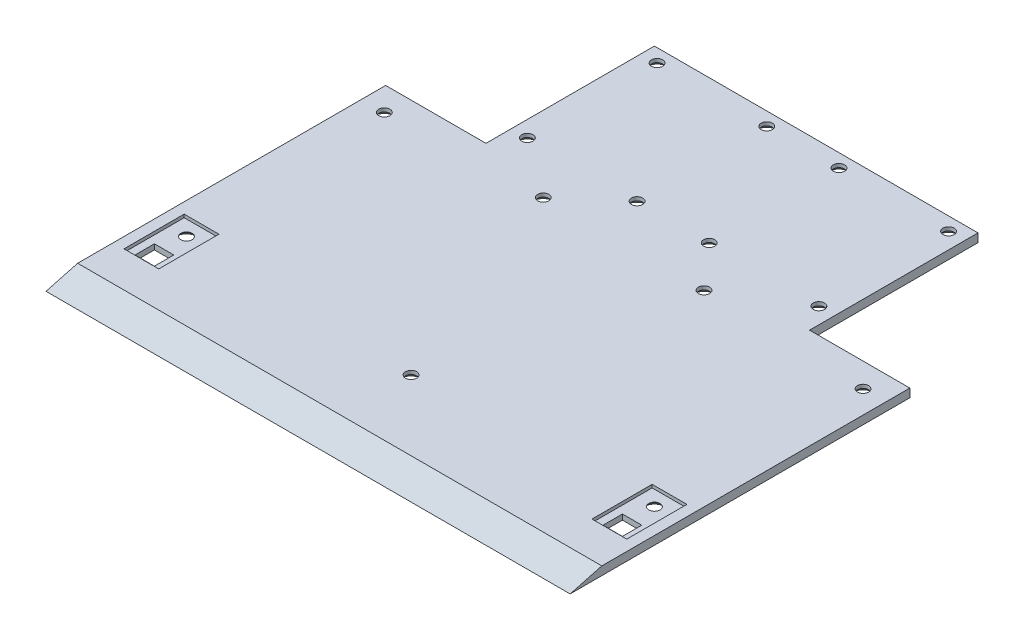
from build123d import *

# Parameters (mm, degrees)
SALIENTE_EXTRUIR1_DEPTH                              = 196
CORTAR_EXTRUIR1_REACH                                = 274.995
CROQUIS2_W                                           = 37.5
CROQUIS2_H                                           = 62.989872981
CROQUIS3_W                                           = 13
CROQUIS3_H                                           = 22.5
CORTAR_EXTRUIR2_DEPTH                                = 1.17
CORTAR_EXTRUIR3_REACH                                = 274.984
CROQUIS5_W                                           = 7.25
CROQUIS5_H                                           = 7.25
CORTAR_EXTRUIR4_REACH                                = 274.984
CROQUIS6_R                                           = 1.6
CUT_EXTRUDE1_REACH                                   = 274.995
SKETCH1_R                                            = 1.585
CUT_EXTRUDE2_REACH                                   = 274.995
SKETCH2_R                                            = 1.585
CUT_EXTRUDE3_REACH                                   = 274.995
SKETCH3_R                                            = 1.579889923
SKETCH3_R_2                                          = 1.585
SKETCH4_R                                            = 1.6
CUT_EXTRUDE4_DEPTH                                   = 4.9
AVELLANADO_PARA_TORNILLO_CON_CABEZA_AVEL_D           = 4.2
AVELLANADO_PARA_TORNILLO_CON_CABEZA_AVEL_DEPTH       = 10
AVELLANADO_PARA_TORNILLO_CON_CABEZA_AVEL_CSINK_D     = 8
AVELLANADO_PARA_TORNILLO_CON_CABEZA_AVEL_CSINK_ANGLE = 92
AVELLANADO_PARA_TORNILLO_CON_CABEZA_AVEL_TIP         = 1.2618073


with BuildPart() as part:
    # Croquis1 → Saliente-Extruir1 (new body)
    with BuildSketch(Plane(origin=(0, 0, 0), x_dir=(0, 0, -1), z_dir=(1, 0, 0))):
        Polygon((0, 0), (190, 0), (190, 3.17), (11.83060106, 3.17), align=None)
    extrude(amount=SALIENTE_EXTRUIR1_DEPTH)

    # Croquis2 → Cortar-Extruir1 (cut, up to next)
    with BuildSketch(Plane(origin=(0, 0, 0), x_dir=(-1, 0, 0), z_dir=(0, -1, 0)), mode=Mode.PRIVATE) as cortar_extruir1_sk1:
        with Locations((-18.75, 158.50506351)):
            Rectangle(CROQUIS2_W, CROQUIS2_H)
    cortar_extruir1_tool1 = extrude(cortar_extruir1_sk1.sketch, amount=-CORTAR_EXTRUIR1_REACH, mode=Mode.PRIVATE) & part.part
    cortar_extruir1 = cortar_extruir1_tool1.solids().sort_by_distance((18.75, 0, -158.505064))[0]
    add(cortar_extruir1, mode=Mode.SUBTRACT)

    # Simetría1: Cortar-Extruir1 across plane
    add(cortar_extruir1.mirror(Plane.ZY.offset(-98)), mode=Mode.SUBTRACT)

    # Croquis3 → Cortar-Extruir2 (cut)
    with BuildSketch(Plane(origin=(0, 3.17, 0), x_dir=(1, 0, 0), z_dir=(0, 1, 0))):
        with Locations((10.5, 36.41)):
            Rectangle(CROQUIS3_W, CROQUIS3_H)
    cortar_extruir2 = extrude(amount=-CORTAR_EXTRUIR2_DEPTH, mode=Mode.SUBTRACT)

    # Croquis5 → Cortar-Extruir3 (cut, up to next)
    with BuildSketch(Plane(origin=(0, 2, 0), x_dir=(1, 0, 0), z_dir=(0, 1, 0)), mode=Mode.PRIVATE) as cortar_extruir3_sk1:
        with Locations((10.5, 30.035)):
            Rectangle(CROQUIS5_W, CROQUIS5_H)
    cortar_extruir3_tool1 = extrude(cortar_extruir3_sk1.sketch, amount=-CORTAR_EXTRUIR3_REACH, mode=Mode.PRIVATE) & part.part
    cortar_extruir3 = cortar_extruir3_tool1.solids().sort_by_distance((10.5, 2, -30.035))[0]
    add(cortar_extruir3, mode=Mode.SUBTRACT)

    # Croquis6 → Cortar-Extruir4 (cut, up to next)
    with BuildSketch(Plane(origin=(0, 2, 0), x_dir=(1, 0, 0), z_dir=(0, 1, 0)), mode=Mode.PRIVATE) as cortar_extruir4_sk1:
        with Locations((10.5, 42.01)):
            Circle(CROQUIS6_R)
    cortar_extruir4_tool1 = extrude(cortar_extruir4_sk1.sketch, amount=-CORTAR_EXTRUIR4_REACH, mode=Mode.PRIVATE) & part.part
    cortar_extruir4 = cortar_extruir4_tool1.solids().sort_by_distance((10.5, 2, -42.01))[0]
    add(cortar_extruir4, mode=Mode.SUBTRACT)

    # Simetría2: Cortar-Extruir2, Cortar-Extruir3, Cortar-Extruir4 across plane
    add(cortar_extruir2.mirror(Plane.ZY.offset(-98)), mode=Mode.SUBTRACT)
    add(cortar_extruir3.mirror(Plane.ZY.offset(-98)), mode=Mode.SUBTRACT)
    add(cortar_extruir4.mirror(Plane.ZY.offset(-98)), mode=Mode.SUBTRACT)

    # Sketch1 → Cut-Extrude1 (cut, up to next)
    with BuildSketch(Plane(origin=(0, 3.17, 0), x_dir=(1, 0, 0), z_dir=(0, 1, 0)), mode=Mode.PRIVATE) as cut_extrude1_sk1:
        with Locations((8.5, 118.010127019)):
            Circle(SKETCH1_R)
    cut_extrude1_tool1 = extrude(cut_extrude1_sk1.sketch, amount=-CUT_EXTRUDE1_REACH, mode=Mode.PRIVATE) & part.part
    # Sketch1 → Cut-Extrude1 (cut, up to next)
    with BuildSketch(Plane(origin=(0, 3.17, 0), x_dir=(1, 0, 0), z_dir=(0, 1, 0)), mode=Mode.PRIVATE) as cut_extrude1_sk2:
        with Locations((187.5, 118.010127019)):
            Circle(SKETCH1_R)
    cut_extrude1_tool2 = extrude(cut_extrude1_sk2.sketch, amount=-CUT_EXTRUDE1_REACH, mode=Mode.PRIVATE) & part.part
    add(cut_extrude1_tool1.solids().sort_by_distance((8.5, 3.17, -118.010127))[0], mode=Mode.SUBTRACT)
    add(cut_extrude1_tool2.solids().sort_by_distance((187.5, 3.17, -118.010127))[0], mode=Mode.SUBTRACT)

    # Sketch2 → Cut-Extrude2 (cut, up to next)
    with BuildSketch(Plane(origin=(0, 3.17, 0), x_dir=(1, 0, 0), z_dir=(0, 1, 0)), mode=Mode.PRIVATE) as cut_extrude2_sk1:
        with Locations((98.5, 38.010127019)):
            Circle(SKETCH2_R)
    cut_extrude2_tool1 = extrude(cut_extrude2_sk1.sketch, amount=-CUT_EXTRUDE2_REACH, mode=Mode.PRIVATE) & part.part
    add(cut_extrude2_tool1.solids().sort_by_distance((98.5, 3.17, -38.010127))[0], mode=Mode.SUBTRACT)

    # Sketch3 → Cut-Extrude3 (cut, up to next)
    with BuildSketch(Plane(origin=(0, 3.17, 0), x_dir=(1, 0, 0), z_dir=(0, 1, 0)), mode=Mode.PRIVATE) as cut_extrude3_sk1:
        with Locations((43.5, 185)):
            Circle(SKETCH3_R)
    cut_extrude3_tool1 = extrude(cut_extrude3_sk1.sketch, amount=-CUT_EXTRUDE3_REACH, mode=Mode.PRIVATE) & part.part
    # Sketch3 → Cut-Extrude3 (cut, up to next)
    with BuildSketch(Plane(origin=(0, 3.17, 0), x_dir=(1, 0, 0), z_dir=(0, 1, 0)), mode=Mode.PRIVATE) as cut_extrude3_sk2:
        with Locations((84.5, 185)):
            Circle(SKETCH3_R_2)
    cut_extrude3_tool2 = extrude(cut_extrude3_sk2.sketch, amount=-CUT_EXTRUDE3_REACH, mode=Mode.PRIVATE) & part.part
    # Sketch3 → Cut-Extrude3 (cut, up to next)
    with BuildSketch(Plane(origin=(0, 3.17, 0), x_dir=(1, 0, 0), z_dir=(0, 1, 0)), mode=Mode.PRIVATE) as cut_extrude3_sk3:
        with Locations((152.5, 185)):
            Circle(SKETCH3_R_2)
    cut_extrude3_tool3 = extrude(cut_extrude3_sk3.sketch, amount=-CUT_EXTRUDE3_REACH, mode=Mode.PRIVATE) & part.part
    # Sketch3 → Cut-Extrude3 (cut, up to next)
    with BuildSketch(Plane(origin=(0, 3.17, 0), x_dir=(1, 0, 0), z_dir=(0, 1, 0)), mode=Mode.PRIVATE) as cut_extrude3_sk4:
        with Locations((111.5, 185)):
            Circle(SKETCH3_R_2)
    cut_extrude3_tool4 = extrude(cut_extrude3_sk4.sketch, amount=-CUT_EXTRUDE3_REACH, mode=Mode.PRIVATE) & part.part
    # Sketch3 → Cut-Extrude3 (cut, up to next)
    with BuildSketch(Plane(origin=(0, 3.17, 0), x_dir=(1, 0, 0), z_dir=(0, 1, 0)), mode=Mode.PRIVATE) as cut_extrude3_sk5:
        with Locations((111.5, 136.5)):
            Circle(SKETCH3_R_2)
    cut_extrude3_tool5 = extrude(cut_extrude3_sk5.sketch, amount=-CUT_EXTRUDE3_REACH, mode=Mode.PRIVATE) & part.part
    # Sketch3 → Cut-Extrude3 (cut, up to next)
    with BuildSketch(Plane(origin=(0, 3.17, 0), x_dir=(1, 0, 0), z_dir=(0, 1, 0)), mode=Mode.PRIVATE) as cut_extrude3_sk6:
        with Locations((152.5, 136.5)):
            Circle(SKETCH3_R_2)
    cut_extrude3_tool6 = extrude(cut_extrude3_sk6.sketch, amount=-CUT_EXTRUDE3_REACH, mode=Mode.PRIVATE) & part.part
    # Sketch3 → Cut-Extrude3 (cut, up to next)
    with BuildSketch(Plane(origin=(0, 3.17, 0), x_dir=(1, 0, 0), z_dir=(0, 1, 0)), mode=Mode.PRIVATE) as cut_extrude3_sk7:
        with Locations((84.5, 136.5)):
            Circle(SKETCH3_R_2)
    cut_extrude3_tool7 = extrude(cut_extrude3_sk7.sketch, amount=-CUT_EXTRUDE3_REACH, mode=Mode.PRIVATE) & part.part
    # Sketch3 → Cut-Extrude3 (cut, up to next)
    with BuildSketch(Plane(origin=(0, 3.17, 0), x_dir=(1, 0, 0), z_dir=(0, 1, 0)), mode=Mode.PRIVATE) as cut_extrude3_sk8:
        with Locations((43.5, 136.5)):
            Circle(SKETCH3_R_2)
    cut_extrude3_tool8 = extrude(cut_extrude3_sk8.sketch, amount=-CUT_EXTRUDE3_REACH, mode=Mode.PRIVATE) & part.part
    add(cut_extrude3_tool1.solids().sort_by_distance((43.5, 3.17, -185))[0], mode=Mode.SUBTRACT)
    add(cut_extrude3_tool2.solids().sort_by_distance((84.5, 3.17, -185))[0], mode=Mode.SUBTRACT)
    add(cut_extrude3_tool3.solids().sort_by_distance((152.5, 3.17, -185))[0], mode=Mode.SUBTRACT)
    add(cut_extrude3_tool4.solids().sort_by_distance((111.5, 3.17, -185))[0], mode=Mode.SUBTRACT)
    add(cut_extrude3_tool5.solids().sort_by_distance((111.5, 3.17, -136.5))[0], mode=Mode.SUBTRACT)
    add(cut_extrude3_tool6.solids().sort_by_distance((152.5, 3.17, -136.5))[0], mode=Mode.SUBTRACT)
    add(cut_extrude3_tool7.solids().sort_by_distance((84.5, 3.17, -136.5))[0], mode=Mode.SUBTRACT)
    add(cut_extrude3_tool8.solids().sort_by_distance((43.5, 3.17, -136.5))[0], mode=Mode.SUBTRACT)

    # Sketch4 → Cut-Extrude4 (cut)
    with BuildSketch(Plane(origin=(0, 3.17, 0), x_dir=(1, 0, 0), z_dir=(0, 1, 0))):
        with Locations((65.776416732, 120.166862559)):
            Circle(SKETCH4_R)
        with Locations((125.876416732, 120.166862559)):
            Circle(SKETCH4_R)
    extrude(amount=-CUT_EXTRUDE4_DEPTH, mode=Mode.SUBTRACT)

    # Avellanado para tornillo con cabeza avellanada en cruz de M3.51
    with Locations(Plane(origin=(187.5, 0, -118.010127019), x_dir=(0, 0, -1), z_dir=(0, -1, 0))):
        with Locations((0, 0), (18.489872981, -35), (2.15673554, -61.623583268), (18.489872981, -76), (18.489872981, -103), (2.15673554, -121.723583268), (18.489872981, -144), (0, -179), (66.989872981, -144), (66.989872981, -103), (66.989872981, -76), (66.989872981, -35), (-76.000127019, -177), (-80, -89), (-76.000127019, -2)):
            CounterSinkHole(AVELLANADO_PARA_TORNILLO_CON_CABEZA_AVEL_D / 2, AVELLANADO_PARA_TORNILLO_CON_CABEZA_AVEL_CSINK_D / 2, depth=AVELLANADO_PARA_TORNILLO_CON_CABEZA_AVEL_DEPTH, counter_sink_angle=AVELLANADO_PARA_TORNILLO_CON_CABEZA_AVEL_CSINK_ANGLE)
            with Locations((0, 0, -(AVELLANADO_PARA_TORNILLO_CON_CABEZA_AVEL_DEPTH + AVELLANADO_PARA_TORNILLO_CON_CABEZA_AVEL_TIP / 2))):  # 118° drill point
                Cone(0, AVELLANADO_PARA_TORNILLO_CON_CABEZA_AVEL_D / 2, AVELLANADO_PARA_TORNILLO_CON_CABEZA_AVEL_TIP, mode=Mode.SUBTRACT)


solid = part.part
